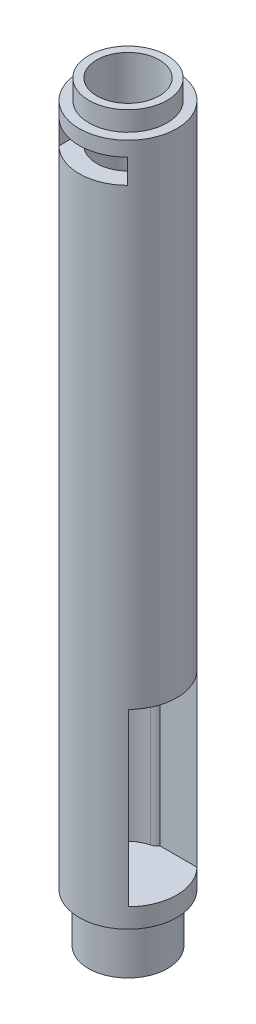
from build123d import *

# Parameters (mm, degrees)
SKETCH1_R           = 12.7
BOSS_EXTRUDE1_DEPTH = 177.8
SKETCH4_R           = 10.16
BOSS_EXTRUDE2_DEPTH = 5.08
SKETCH5_R           = 8.128
CUT_EXTRUDE1_DEPTH  = 184.759828036
SKETCH6_R           = 10.287
SKETCH6_R_2         = 8.128
BOSS_EXTRUDE3_DEPTH = 12.7
SKETCH9_W           = 17.78
SKETCH9_H           = 44.45
CUT_EXTRUDE2_DEPTH  = 14.478
FILLET2_R           = 2.54
BOSS_EXTRUDE4_START = -17.78
SKETCH10_R          = 8.128
BOSS_EXTRUDE4_DEPTH = 17.78
SKETCH11_W          = 17.78
SKETCH11_H          = 6.35
CUT_EXTRUDE3_DEPTH  = 9.652
FILLET3_R           = 2.54


with BuildPart() as part:
    # Sketch1 → Boss-Extrude1 (new body)
    with BuildSketch(Plane(origin=(0, 0, 0), x_dir=(1, 0, 0), z_dir=(0, 1, 0))):
        with Locations(Location((0, 0, 0), (0, 0, 270))):
            Circle(SKETCH1_R)
    extrude(amount=BOSS_EXTRUDE1_DEPTH)

    # Sketch4 → Boss-Extrude2 (add)
    with BuildSketch(Plane(origin=(0, 177.8, 0), x_dir=(1, 0, 0), z_dir=(0, 1, 0))):
        with Locations(Location((0, 0, 0), (0, 0, 270))):
            Circle(SKETCH4_R)
    extrude(amount=BOSS_EXTRUDE2_DEPTH)

    # Sketch5 → Cut-Extrude1 (cut, through all)
    with BuildSketch(Plane(origin=(0, 182.88, 0), x_dir=(1, 0, 0), z_dir=(0, 1, 0))):
        with Locations(Location((0, 0, 0), (0, 0, 270))):
            Circle(SKETCH5_R)
    extrude(amount=-CUT_EXTRUDE1_DEPTH, mode=Mode.SUBTRACT)

    # Sketch6 → Boss-Extrude3 (add)
    with BuildSketch(Plane.XZ):
        with Locations(Location((0, 0, 0), (0, 0, 90))):
            Circle(SKETCH6_R)
        with Locations(Location((0, 0, 0), (0, 0, 90))):
            Circle(SKETCH6_R_2, mode=Mode.SUBTRACT)
    extrude(amount=BOSS_EXTRUDE3_DEPTH)


with BuildPart() as body_2:
    # Split1: the piece on the far side of the plane
    add(part.part)
    split(bisect_by=Plane(origin=(0, 2.54, 0), x_dir=(0, 0, -1), z_dir=(0, -1, 0)), keep=Keep.BOTTOM)

    # Sketch9 → Cut-Extrude2 (cut)
    with BuildSketch(Plane(origin=(13.97, 0, 0), x_dir=(0, 0, -1), z_dir=(1, 0, 0))):
        with Locations((0, 27.305)):
            Rectangle(SKETCH9_W, SKETCH9_H)
    extrude(amount=-CUT_EXTRUDE2_DEPTH, mode=Mode.SUBTRACT)

    # Fillet2
    # the kernel refuses this fillet: 2.54 mm, written as the material it takes off along each edge
    with BuildSketch(Plane(origin=(-0.508, 5.08, -8.112109467), x_dir=(-0.988207128280474, 0, 0.15312306036537704), z_dir=(0, 1, 0))) as fillet2_piece_1:
        with BuildLine():
            CenterArc((1.711577927, -2.529447161), FILLET2_R, 95.224634403, 40.891343564)
            Line((-0.119112979, -0.76871697), (-0.155726797, -0.733502366))
            ThreePointArc((-0.155726797, -0.733502366), (-0.109757412, -0.376579834), (-0.050200922, 0.007778651))
            Line((-0.050200922, 0.007778651), (0.004625886, 0.050588943))
            ThreePointArc((0.004625886, 0.050588943), (0.740141806, 0.017030915), (1.475657727, 0.050588943))
            Line((1.475657727, 0.050588943), (1.480283613, 0))
        make_face()
    extrude(amount=44.45, mode=Mode.SUBTRACT)
    with BuildSketch(Plane(origin=(-0.508, 5.08, 8.112109467), x_dir=(-0.9882071282804739, 0, -0.15312306036537726), z_dir=(0, 1, 0))) as fillet2_piece_2:
        with BuildLine():
            CenterArc((1.711577927, 2.529447161), FILLET2_R, 223.884022033, 40.891343564)
            Line((-0.119112979, 0.76871697), (-0.155726797, 0.733502366))
            ThreePointArc((-0.155726797, 0.733502366), (-0.109757412, 0.376579834), (-0.050200922, -0.007778651))
            Line((-0.050200922, -0.007778651), (0.004625886, -0.050588943))
            ThreePointArc((0.004625886, -0.050588943), (0.740141806, -0.017030915), (1.475657727, -0.050588943))
            Line((1.475657727, -0.050588943), (1.480283613, 0))
        make_face()
    extrude(amount=44.45, mode=Mode.SUBTRACT)


with BuildPart() as part_1:
    add(part.part)

    # Split1
    split(bisect_by=Plane(origin=(0, 2.54, 0), x_dir=(0, 0, -1), z_dir=(0, -1, 0)), keep=Keep.TOP)

    add(body_2.part)  # Boss-Extrude4 merges body 2
    # Sketch10 → Boss-Extrude4 (add)
    with BuildSketch(Plane.XZ.offset(12.7).offset(BOSS_EXTRUDE4_START)):
        with Locations(Location((0, 0, 0), (0, 0, 90))):
            Circle(SKETCH10_R)
    extrude(amount=BOSS_EXTRUDE4_DEPTH)

    # Sketch11 → Cut-Extrude3 (cut)
    with BuildSketch(Plane.XY.offset(13.97)):
        with Locations((0, 170.815)):
            Rectangle(SKETCH11_W, SKETCH11_H)
    extrude(amount=-CUT_EXTRUDE3_DEPTH, mode=Mode.SUBTRACT)

    # Fillet3
    # the kernel refuses this fillet: 2.54 mm, written as the material it takes off along each edge
    with BuildSketch(Plane(origin=(-6.88616439, 167.64, 4.318), x_dir=(-1, 0, 0), z_dir=(0, 1, 0))) as fillet3_piece_1:
        with BuildLine():
            CenterArc((3.533151107, -2.028002493), FILLET3_R, 127.019924819, 65.375681648)
            Line((1.052361703, -2.573239995), (1.002745915, -2.584144745))
            ThreePointArc((1.002745915, -2.584144745), (0.589996771, -1.260521604), (-0.043038527, -0.0269875))
            Line((-0.043038527, -0.0269875), (0, 0.0508))
            ThreePointArc((0, 0.0508), (1.001917805, 0.0508), (1.973249301, 0.04056005))
            Line((1.973249301, 0.04056005), (2.00383561, 0))
        make_face()
    extrude(amount=6.35, mode=Mode.SUBTRACT)
    with BuildSketch(Plane(origin=(6.88616439, 167.64, 4.318), x_dir=(0.3785319660304678, 0, -0.9255882187523287), z_dir=(0, 1, 0))) as fillet3_piece_2:
        with BuildLine():
            CenterArc((3.21450585, -2.502579269), FILLET3_R, 99.847172395, 65.375681648)
            Line((0.758515833, -1.854726633), (0.709396033, -1.841769581))
            ThreePointArc((0.709396033, -1.841769581), (0.332238035, -0.946592741), (-0.047019882, -0.019229424))
            Line((-0.047019882, -0.019229424), (0.008687854, 0.050051585))
            ThreePointArc((0.008687854, 0.050051585), (1.390056584, -0.068946339), (2.771425314, 0.050051585))
            Line((2.771425314, 0.050051585), (2.780113168, 0))
        make_face()
    extrude(amount=6.35, mode=Mode.SUBTRACT)


solid = part_1.part
